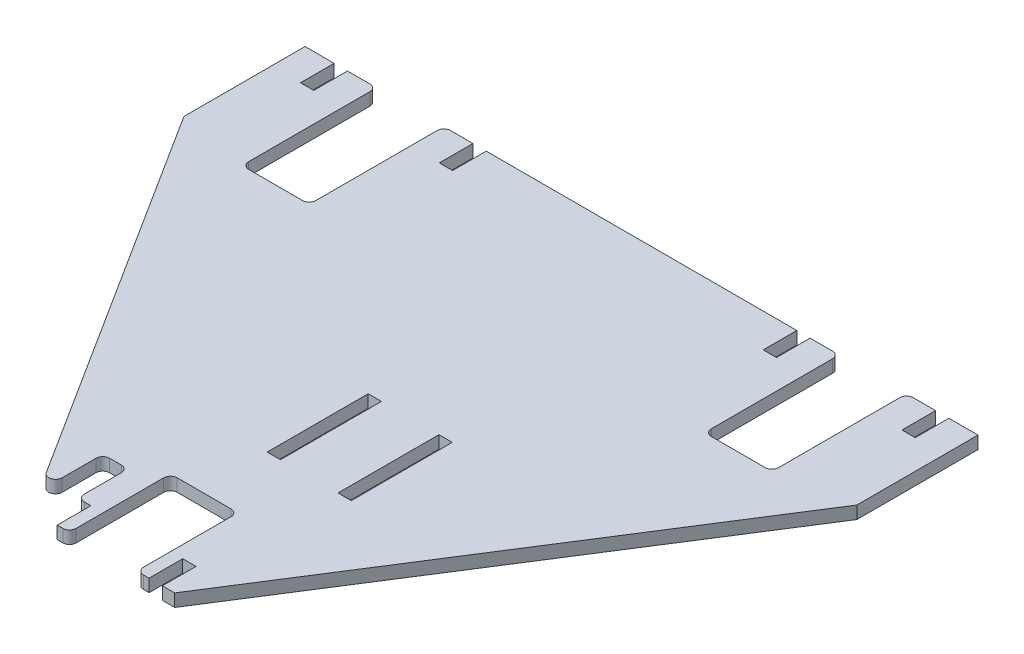
from build123d import *

# Parameters (mm, degrees)
BOSS_EXTRUDE1_DEPTH = 4.7625
SKETCH2_W           = 5.0165
SKETCH2_H           = 38.1
SKETCH2_W_2         = 9.525
SKETCH2_H_2         = 31.75
CUT_EXTRUDE1_DEPTH  = 163.709069834
FILLET1_R           = 2.54
FILLET2_R           = 2.54


with BuildPart() as part:
    # Sketch1 → Boss-Extrude1 (new body)
    with BuildSketch(Plane(origin=(0, 0, 0), x_dir=(1, 0, 0), z_dir=(0, 1, 0))):
        Polygon((12.7, -63.5), (-12.7, -63.5), (-12.7, -101.6), (-17.3355, -101.6), (-17.3355, -88.9), (-22.352, -88.9), (-22.352, -101.6), (-26.9875, -101.6), (-127, 55.88), (-127, 101.6), (-116.0145, 101.6), (-116.0145, 88.9), (-110.998, 88.9), (-110.998, 101.6), (-100.0125, 101.6), (-100.0125, 50.8), (-74.6125, 50.8), (-74.6125, 101.6), (-63.627, 101.6), (-63.627, 88.9), (-58.6105, 88.9), (-58.6105, 101.6), (58.6105, 101.6), (58.6105, 88.9), (63.627, 88.9), (63.627, 101.6), (74.6125, 101.6), (74.6125, 50.8), (100.0125, 50.8), (100.0125, 101.6), (110.998, 101.6), (110.998, 88.9), (116.0145, 88.9), (116.0145, 101.6), (127, 101.6), (127, 55.88), (26.9875, -101.6), (22.352, -101.6), (22.352, -88.9), (17.3355, -88.9), (17.3355, -101.6), (12.7, -101.6), align=None)
    extrude(amount=BOSS_EXTRUDE1_DEPTH)

    # Sketch2 → Cut-Extrude1 (cut, through all)
    with BuildSketch(Plane(origin=(0, 4.7625, 0), x_dir=(1, 0, 0), z_dir=(0, 1, 0))):
        with Locations((0.92075, -19.05)):
            Rectangle(SKETCH2_W, SKETCH2_H)
        with Locations((-27.1145, -85.725)):
            Rectangle(SKETCH2_W_2, SKETCH2_H_2)
        with Locations((27.65425, -19.05)):
            Rectangle(SKETCH2_W, SKETCH2_H)
    extrude(amount=-CUT_EXTRUDE1_DEPTH, mode=Mode.SUBTRACT)

    # Fillet1
    fillet1_edges = [part.edges().sort_by_distance(p)[0] for p in [
        (-22.352, 2.38125, 88.9),
        (-31.877, 2.38125, 93.900977778),
        (-22.352, 2.38125, 69.85),
        (-31.877, 2.38125, 69.85),
    ]]
    fillet(fillet1_edges, radius=FILLET1_R)

    # Fillet2
    fillet2_edges = [part.edges().sort_by_distance(p)[0] for p in [
        (-12.7, 2.38125, 101.6),
        (12.7, 2.38125, 101.6),
        (12.7, 2.38125, 63.5),
        (-12.7, 2.38125, 63.5),
        (100.0125, 2.38125, -101.6),
        (100.0125, 2.38125, -50.8),
        (74.6125, 2.38125, -101.6),
        (74.6125, 2.38125, -50.8),
        (-100.0125, 2.38125, -101.6),
        (-74.6125, 2.38125, -101.6),
        (-74.6125, 2.38125, -50.8),
        (-100.0125, 2.38125, -50.8),
    ]]
    fillet(fillet2_edges, radius=FILLET2_R)


solid = part.part
